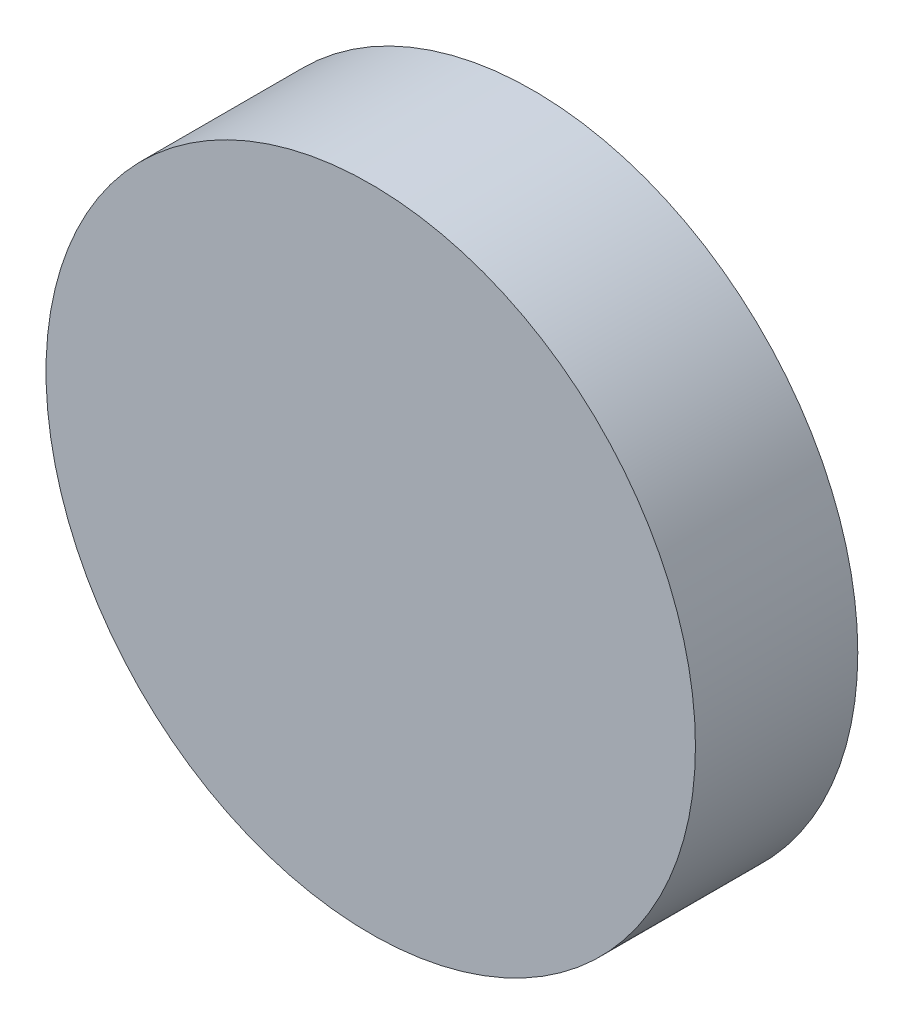
from build123d import *

# Parameters (mm, degrees)
SKETCH1_R           = 2
BOSS_EXTRUDE1_DEPTH = 0.5


with BuildPart() as part:
    # Sketch1 → Boss-Extrude1 (new, symmetric)
    with BuildSketch(Plane.XY):
        Circle(SKETCH1_R)
    extrude(amount=BOSS_EXTRUDE1_DEPTH, both=True)


solid = part.part
